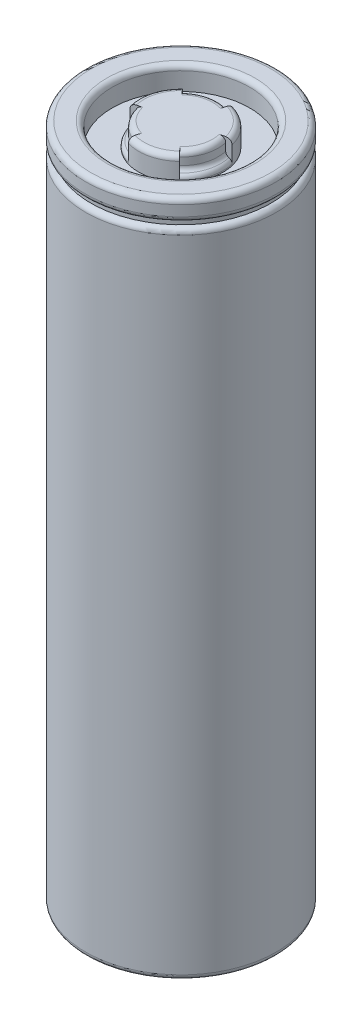
from build123d import *

# Parameters (mm, degrees)
FILLET1_R           = 0.5
FILLET2_R           = 0.5
SKETCH3_R           = 6.5
CUT_EXTRUDE1_DEPTH  = 2.2
SKETCH4_R           = 4
BOSS_EXTRUDE1_DEPTH = 2.2
FILLET3_R           = 0.5
CUT_EXTRUDE3_START  = -2.2
CUT_EXTRUDE3_DEPTH  = 2.2
CIRPATTERN1_COUNT   = 3
FILLET4_R           = 0.5
FILLET5_R           = 0.5
FILLET6_R           = 0.5


# Some blends are built 0.0001 mm under size
with BuildPart() as part:
    # Sketch2 → Revolve1 (revolve)
    with BuildSketch(Plane.XY, mode=Mode.PRIVATE) as revolve1_sk:
        Polygon((-12.142428786, -5.689655172), (-12.142428786, 58.310344828), (-3.142428786, 58.310344828), (-3.142428786, 56.310344828), (-3.642428786, 56.310344828), (-3.642428786, 55.810344828), (-3.142428786, 55.810344828), (-3.142428786, -5.689655172), align=None)
    revolve(revolve1_sk.sketch.rotate(Axis((-12.142428786, -5.689655172, 0), (0, 1, 0)), 90), axis=Axis((-12.142428786, -5.689655172, 0), (0, 1, 0)))

    # Fillet1
    fillet1_edges = [part.edges().sort_by_distance(p)[0] for p in [
        (-12.142428786, -5.689655172, 9),
    ]]
    fillet(fillet1_edges, radius=FILLET1_R)

    # Fillet2
    fillet2_edges = [part.edges().sort_by_distance(p)[0] for p in [
        (-12.142428786, 55.810344828, 9),
        (-12.142428786, 56.310344828, 9),
    ]]
    fillet(fillet2_edges, radius=FILLET2_R - 0.0001)  # a hair under: the kernel refuses the full size

    # Sketch3 → Cut-Extrude1 (cut)
    with BuildSketch(Plane(origin=(0, 58.310344828, 0), x_dir=(1, 0, 0), z_dir=(0, 1, 0))):
        with Locations(Location((-12.142428786, 0, 0), (0, 0, 270))):
            Circle(SKETCH3_R)
    extrude(amount=-CUT_EXTRUDE1_DEPTH, mode=Mode.SUBTRACT)

    # Sketch4 → Boss-Extrude1 (add)
    with BuildSketch(Plane(origin=(0, 56.110344828, 0), x_dir=(1, 0, 0), z_dir=(0, 1, 0))):
        with Locations(Location((-12.142428786, 0, 0), (0, 0, 270))):
            Circle(SKETCH4_R)
    extrude(amount=BOSS_EXTRUDE1_DEPTH)

    # Fillet3
    fillet3_edges = [part.edges().sort_by_distance(p)[0] for p in [
        (-12.142428786, 58.310344828, -6.5),
        (-12.142428786, 58.310344828, 9),
    ]]
    fillet(fillet3_edges, radius=FILLET3_R)

    # Sketch6 → Cut-Extrude3 (cut)
    with BuildSketch(Plane(origin=(0, 58.810344828, 0), x_dir=(1, 0, 0), z_dir=(0, 1, 0)).offset(CUT_EXTRUDE3_START)):
        with BuildLine():
            Line((-8.254547449, 0.940414119), (-8.740532616, 0.822862354))
            ThreePointArc((-8.740532616, 0.822862354), (-8.667041283, 0.414344909), (-8.642428786, 0))
            ThreePointArc((-8.642428786, 0), (-8.925482465, -1.378860534), (-9.728860999, -2.534697327))
            Line((-9.728860999, -2.534697327), (-9.384065601, -2.896796945))
            ThreePointArc((-9.384065601, -2.896796945), (-8.305217722, -1.129518151), (-8.254547449, 0.940414119))
        make_face()
    cut_extrude3 = extrude(amount=CUT_EXTRUDE3_DEPTH, mode=Mode.SUBTRACT)

    # CirPattern1: Cut-Extrude3 ×3 about axis
    cirpattern1_axis = Axis((-12.142428786, 0, 0), (0, 1, 0))
    for i in range(1, CIRPATTERN1_COUNT):
        add(cut_extrude3.rotate(cirpattern1_axis, i * 360 / CIRPATTERN1_COUNT), mode=Mode.SUBTRACT)

    # Fillet4
    fillet4_edges = [part.edges().sort_by_distance(p)[0] for p in [
        (-12.965291139, 58.310344828, -3.401896169),
        (-9.245631841, 58.310344828, -2.758363185),
        (-8.784869105, 58.310344828, 0.988328382),
        (-10.657031159, 58.310344828, 3.713972791),
        (-14.677126112, 58.310344828, 2.413567787),
        (-15.979639849, 58.310344828, -1.129518151),
    ]]
    fillet(fillet4_edges, radius=FILLET4_R - 0.0001)  # a hair under: the kernel refuses the full size

    # Fillet5
    fillet5_edges = [part.edges().sort_by_distance(p)[0] for p in [
        (-12.965291139, 56.610344828, -3.401896169),
        (-8.784869105, 56.610344828, 0.988328382),
        (-14.677126112, 56.610344828, 2.413567787),
    ]]
    fillet(fillet5_edges, radius=FILLET5_R - 0.0001)  # a hair under: the kernel refuses the full size

    # Fillet6
    # the kernel refuses this fillet: 0.5 mm, written as the material it takes off along each edge
    with BuildSketch(Plane(origin=(-12.142428786, 56.610344828, 0), x_dir=(0.6895907962440411, 0, 0.7241992362157734), z_dir=(-0.7241992362157734, 0, 0.6895907962440411))) as fillet6_piece_1:
        with BuildLine():
            CenterArc((3.5, -0.366067667), FILLET6_R, 0, 60.003308249)
            Line((3.749974997, 0.066959469), (3.774972497, 0.110262183))
            ThreePointArc((3.774972497, 0.110262183), (3.9999, 0.05), (4, 0.05))
            Line((4, 0.05), (4.05, 0))
            Line((4.05, 0), (4.05, -0.366067667))
            Line((4.05, -0.366067667), (4, -0.366067667))
        make_face()
    revolve(axis=Axis((-12.142428786, 56.610344828, 0), (0, 1, 0)), revolution_arc=60, mode=Mode.SUBTRACT)
    with BuildSketch(Plane(origin=(-12.142428786, 56.610344828, 0), x_dir=(0.28237953784212716, 0, -0.9593027658711648), z_dir=(0.9593027658711648, 0, 0.28237953784212716))) as fillet6_piece_2:
        with BuildLine():
            CenterArc((3.5, -0.366067667), FILLET6_R, 0, 60.003308249)
            Line((4, -0.366067667), (4.05, -0.366067667))
            Line((4.05, -0.366067667), (4.05, 0))
            Line((4.05, 0), (4, 0.05))
            ThreePointArc((4, 0.05), (3.9999, 0.05), (3.774972497, 0.110262183))
            Line((3.774972497, 0.110262183), (3.749974997, 0.066959469))
        make_face()
    revolve(axis=Axis((-12.142428786, 56.610344828, 0), (0, 1, 0)), revolution_arc=60, mode=Mode.SUBTRACT)
    with BuildSketch(Plane(origin=(-12.142428786, 56.610344828, 0), x_dir=(-0.9719703340861678, 0, 0.23510352965539105), z_dir=(-0.23510352965539105, 0, -0.9719703340861678))) as fillet6_piece_3:
        with BuildLine():
            CenterArc((3.5, -0.366067667), FILLET6_R, 0, 60.003308249)
            Line((3.749974997, 0.066959469), (3.774972497, 0.110262183))
            ThreePointArc((3.774972497, 0.110262183), (3.9999, 0.05), (4, 0.05))
            Line((4, 0.05), (4.05, 0))
            Line((4.05, 0), (4.05, -0.366067667))
            Line((4.05, -0.366067667), (4, -0.366067667))
        make_face()
    revolve(axis=Axis((-12.142428786, 56.610344828, 0), (0, 1, 0)), revolution_arc=60, mode=Mode.SUBTRACT)


solid = part.part
